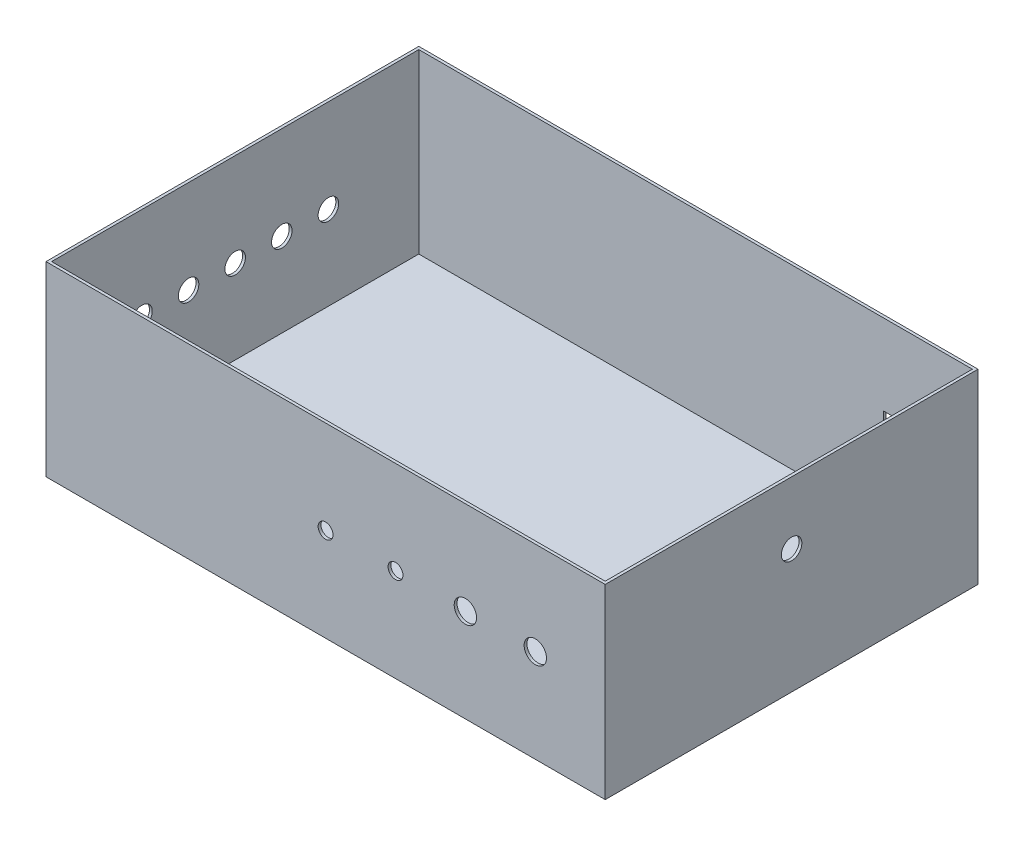
from build123d import *

# Parameters (mm, degrees)
SKETCH1_W           = 600
SKETCH1_H           = 400
BOSS_EXTRUDE1_DEPTH = 200
SKETCH2_W           = 594
SKETCH2_H           = 394
CUT_EXTRUDE1_DEPTH  = 190
SKETCH3_R           = 11
CUT_EXTRUDE2_DEPTH  = 10
SKETCH4_R           = 12
SKETCH4_R_2         = 8
CUT_EXTRUDE3_DEPTH  = 10
SKETCH5_W           = 47
SKETCH5_H           = 27
CUT_EXTRUDE4_DEPTH  = 10
SKETCH6_R           = 11
CUT_EXTRUDE5_DEPTH  = 10


with BuildPart() as part:
    # Sketch1 → Boss-Extrude1 (new body)
    with BuildSketch(Plane(origin=(0, 0, 0), x_dir=(1, 0, 0), z_dir=(0, 1, 0))):
        Rectangle(SKETCH1_W, SKETCH1_H)
    extrude(amount=BOSS_EXTRUDE1_DEPTH)

    # Sketch2 → Cut-Extrude1 (cut)
    with BuildSketch(Plane(origin=(0, 200, 0), x_dir=(1, 0, 0), z_dir=(0, 1, 0))):
        Rectangle(SKETCH2_W, SKETCH2_H)
    extrude(amount=-CUT_EXTRUDE1_DEPTH, mode=Mode.SUBTRACT)

    # Sketch3 → Cut-Extrude2 (cut)
    with BuildSketch(Plane.ZY.offset(300)):
        with Locations((-100, 100)):
            Circle(SKETCH3_R)
        with Locations((-50, 100)):
            Circle(SKETCH3_R)
        with Locations((50, 100)):
            Circle(SKETCH3_R)
        with Locations((100, 100)):
            Circle(SKETCH3_R)
        with Locations((0, 100)):
            Circle(SKETCH3_R)
    extrude(amount=-CUT_EXTRUDE2_DEPTH, mode=Mode.SUBTRACT)

    # Sketch4 → Cut-Extrude3 (cut)
    with BuildSketch(Plane.XY.offset(200)):
        with Locations((150, 100)):
            Circle(SKETCH4_R)
        with Locations((75, 100)):
            Circle(SKETCH4_R_2)
        with Locations((225, 100)):
            Circle(SKETCH4_R)
        with Locations((0, 100)):
            Circle(SKETCH4_R_2)
    extrude(amount=-CUT_EXTRUDE3_DEPTH, mode=Mode.SUBTRACT)

    # Sketch5 → Cut-Extrude4 (cut)
    with BuildSketch(Plane(origin=(0, 0, -200), x_dir=(-1, 0, 0), z_dir=(0, 0, -1))):
        with Locations((-225, 100)):
            Rectangle(SKETCH5_W, SKETCH5_H)
    extrude(amount=-CUT_EXTRUDE4_DEPTH, mode=Mode.SUBTRACT)

    # Sketch6 → Cut-Extrude5 (cut)
    with BuildSketch(Plane(origin=(300, 0, 0), x_dir=(0, 0, -1), z_dir=(1, 0, 0))):
        with Locations((0, 133)):
            Circle(SKETCH6_R)
    extrude(amount=-CUT_EXTRUDE5_DEPTH, mode=Mode.SUBTRACT)


solid = part.part
